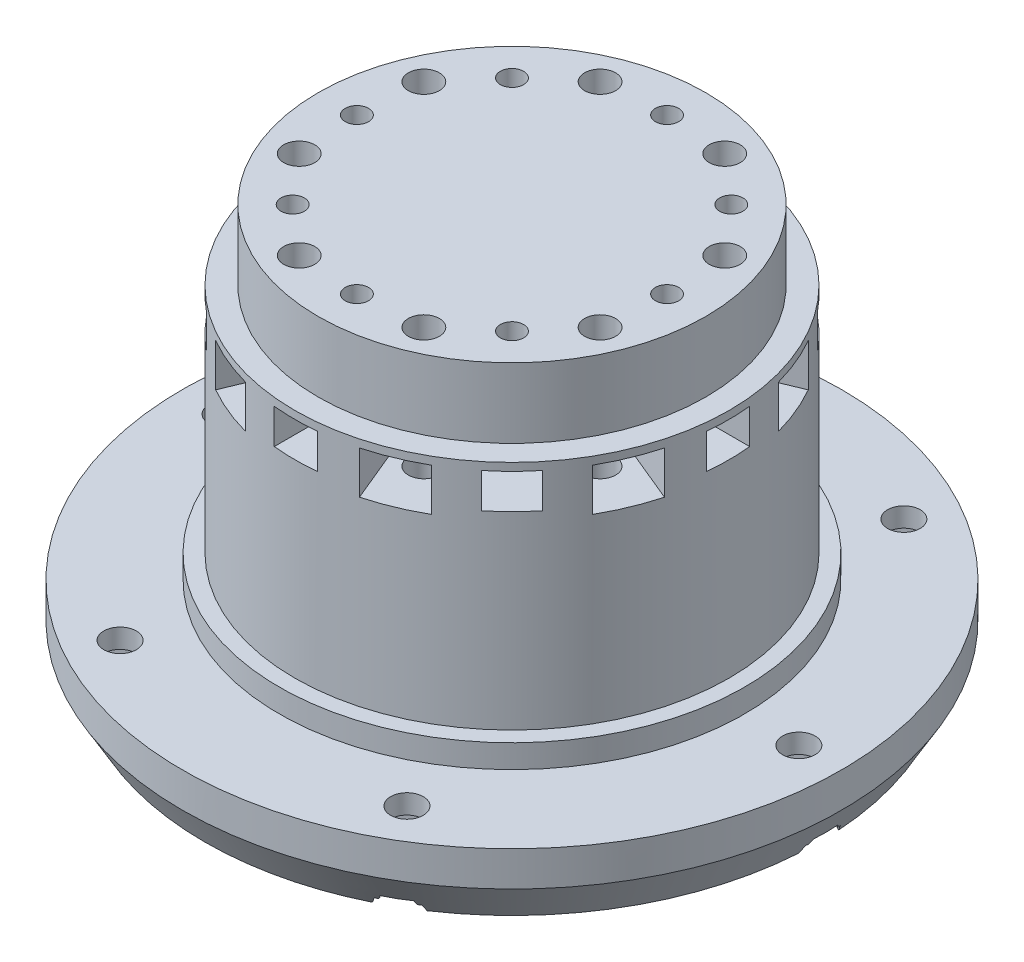
from build123d import *

# Parameters (mm, degrees)
SKETCH21_R          = 3.175
CUT_EXTRUDE13_DEPTH = 3.16
SKETCH18_R          = 2.1
CUT_EXTRUDE11_DEPTH = 80.085143991
CUT_EXTRUDE12_DEPTH = 7
SKETCH20_R          = 0.4
BOSS_EXTRUDE1_DEPTH = 2.5
CIRPATTERN1_COUNT   = 6
CHAMFER1_SIZE       = 2.886751346
CHAMFER1_SIZE_2     = 5
SKETCH22_R          = 1.5
SKETCH22_R_2        = 2
CUT_EXTRUDE14_DEPTH = 20
CUT_EXTRUDE15_START = -14.5
SKETCH23_R          = 1.5
CUT_EXTRUDE15_DEPTH = 4.5
CUT_EXTRUDE16_START = -15.5
SKETCH23_3_R        = 2
CUT_EXTRUDE16_DEPTH = 5.5
CIRPATTERN2_COUNT   = 8


with BuildPart() as part:
    # Sketch1 → Revolve1 (revolve)
    with BuildSketch(Plane.XY, mode=Mode.PRIVATE) as revolve1_sk:
        Polygon((0, 0), (-42.5, 0), (-42.5, 9.5), (-30, 9.5), (-30, 12.5), (0, 12.5), align=None)
    revolve(revolve1_sk.sketch.rotate(Axis((0, 0, 0), (0, 1, 0)), 270), axis=Axis((0, 0, 0), (0, 1, 0)))

    # Sketch2 → Revolve2 (revolve)
    with BuildSketch(Plane.XY, mode=Mode.PRIVATE) as revolve2_sk:
        Polygon((-28, 41.4), (-28, 12.5), (0, 12.5), (0, 41.4), (0, 51.4), (-25, 51.4), (-25, 42.4), (-28, 42.4), align=None)
        Polygon((0, -8.6), (-15, -8.6), (-15, -0.6), (-17.5, -0.6), (-17.5, 0), (0, 0), align=None)
    revolve(revolve2_sk.sketch.rotate(Axis((0, 0, 0), (0, 1, 0)), 270), axis=Axis((0, 0, 0), (0, 1, 0)))

    # Sketch21 → Cut-Extrude13 (cut)
    with BuildSketch(Plane.XZ.offset(8.6)):
        with Locations(Location((0, 0, 0), (0, 0, 270))):
            Circle(SKETCH21_R)
    extrude(amount=-CUT_EXTRUDE13_DEPTH, mode=Mode.SUBTRACT)

    # Sketch18 → Cut-Extrude11 (cut, through all)
    with BuildSketch(Plane.XZ):
        with Locations(Location((-37, 0, 0), (0, 0, 270))):
            Circle(SKETCH18_R)
        with Locations(Location((-18.5, 32.04293994, 0), (0, 0, 270))):
            Circle(SKETCH18_R)
        with Locations(Location((18.5, 32.04293994, 0), (0, 0, 270))):
            Circle(SKETCH18_R)
        with Locations(Location((37, 0, 0), (0, 0, 270))):
            Circle(SKETCH18_R)
        with Locations(Location((18.5, -32.04293994, 0), (0, 0, 270))):
            Circle(SKETCH18_R)
        with Locations(Location((-18.5, -32.04293994, 0), (0, 0, 270))):
            Circle(SKETCH18_R)
    extrude(amount=-CUT_EXTRUDE11_DEPTH, mode=Mode.SUBTRACT)

    # Sketch19 → Cut-Extrude12 (cut)
    with BuildSketch(Plane.XZ):
        Polygon((-33.5, -2.020725942), (-33.5, 2.020725942), (-37, 4.041451884), (-40.5, 2.020725942), (-40.5, -2.020725942), (-37, -4.041451884), align=None)
    cut_extrude12 = extrude(amount=-CUT_EXTRUDE12_DEPTH, mode=Mode.SUBTRACT)

    # Sketch20 → Boss-Extrude1 (add)
    with BuildSketch(Plane.XZ):
        with Locations((-40.5, 2.020725942)):
            Circle(SKETCH20_R)
        with Locations((-37, 4.041451884)):
            Circle(SKETCH20_R)
        with Locations((-33.5, 2.020725942)):
            Circle(SKETCH20_R)
        with Locations((-33.5, -2.020725942)):
            Circle(SKETCH20_R)
        with Locations((-37, -4.041451884)):
            Circle(SKETCH20_R)
        with Locations((-40.5, -2.020725942)):
            Circle(SKETCH20_R)
    boss_extrude1 = extrude(amount=-BOSS_EXTRUDE1_DEPTH)

    # CirPattern1: Cut-Extrude12, Boss-Extrude1 ×6 about axis
    cirpattern1_axis = Axis((0, 0, 0), (0, 1, 0))
    add([cut_extrude12.rotate(cirpattern1_axis, i * 360 / CIRPATTERN1_COUNT) for i in range(1, CIRPATTERN1_COUNT)], mode=Mode.SUBTRACT)
    add([boss_extrude1.rotate(cirpattern1_axis, i * 360 / CIRPATTERN1_COUNT) for i in range(1, CIRPATTERN1_COUNT)])

    # Chamfer1
    # the kernel refuses this chamfer: 5, 2.886751346 mm, written as the material it takes off along each edge
    with BuildSketch(Plane(origin=(0, 0, 0), x_dir=(0, 0, -1), z_dir=(1, 0, 0))) as chamfer1_piece_1:
        Polygon((42.5 - CHAMFER1_SIZE, 0), (42.5, CHAMFER1_SIZE_2), (42.5, 0), align=None)
    revolve(axis=Axis((0, 0, 0), (0, 1, 0)), mode=Mode.SUBTRACT)

    # Sketch22 → Cut-Extrude14 (cut)
    with BuildSketch(Plane(origin=(0, 51.4, 0), x_dir=(1, 0, 0), z_dir=(0, 1, 0))):
        with Locations(Location((0, 20, 0), (0, 0, 270))):
            Circle(SKETCH22_R)
        with Locations(Location((8.03635208, 19.401470183, 0), (0, 0, 270))):
            Circle(SKETCH22_R_2)
        with Locations(Location((14.142135624, 14.142135624, 0), (0, 0, 270))):
            Circle(SKETCH22_R)
        with Locations(Location((19.401470183, 8.03635208, 0), (0, 0, 270))):
            Circle(SKETCH22_R_2)
        with Locations(Location((20, 0, 0), (0, 0, 270))):
            Circle(SKETCH22_R)
        with Locations(Location((19.401470183, -8.03635208, 0), (0, 0, 270))):
            Circle(SKETCH22_R_2)
        with Locations(Location((14.142135624, -14.142135624, 0), (0, 0, 270))):
            Circle(SKETCH22_R)
        with Locations(Location((8.03635208, -19.401470183, 0), (0, 0, 270))):
            Circle(SKETCH22_R_2)
        with Locations(Location((0, -20, 0), (0, 0, 270))):
            Circle(SKETCH22_R)
        with Locations(Location((-8.03635208, -19.401470183, 0), (0, 0, 270))):
            Circle(SKETCH22_R_2)
        with Locations(Location((-14.142135624, -14.142135624, 0), (0, 0, 270))):
            Circle(SKETCH22_R)
        with Locations(Location((-19.401470183, -8.03635208, 0), (0, 0, 270))):
            Circle(SKETCH22_R_2)
        with Locations(Location((-20, 0, 0), (0, 0, 270))):
            Circle(SKETCH22_R)
        with Locations(Location((-19.401470183, 8.03635208, 0), (0, 0, 270))):
            Circle(SKETCH22_R_2)
        with Locations(Location((-14.142135624, 14.142135624, 0), (0, 0, 270))):
            Circle(SKETCH22_R)
        with Locations(Location((-8.03635208, 19.401470183, 0), (0, 0, 270))):
            Circle(SKETCH22_R_2)
    extrude(amount=-CUT_EXTRUDE14_DEPTH, mode=Mode.SUBTRACT)

    # Sketch23 → Cut-Extrude15 (cut)
    # profile 1 of 2: a face of its own
    with BuildSketch(Plane(origin=(0, 51.4, 0), x_dir=(1, 0, 0), z_dir=(0, 1, 0)).offset(CUT_EXTRUDE15_START)):
        with BuildLine():
            Line((-2.8, 24.842705167), (-2.8, 21.616580754))
            Line((-2.8, 21.616580754), (-2.8, 18.383419246))
            Line((-2.8, 18.383419246), (0, 16.766838493))
            Line((0, 16.766838493), (2.8, 18.383419246))
            Line((2.8, 18.383419246), (2.8, 21.616580754))
            Line((2.8, 21.616580754), (2.8, 24.842705167))
            ThreePointArc((2.8, 24.842705167), (0, 25), (-2.8, 24.842705167))
        make_face()
        with Locations(Location((0, 20, 0), (0, 0, 270))):
            Circle(SKETCH23_R, mode=Mode.SUBTRACT)
    # profile 2 of 2: a face of its own
    with BuildSketch(Plane(origin=(0, 51.4, 0), x_dir=(1, 0, 0), z_dir=(0, 1, 0)).offset(CUT_EXTRUDE15_START)):
        with BuildLine():
            Line((-2.8, 27.859648239), (-2.8, 24.842705167))
            ThreePointArc((-2.8, 24.842705167), (0, 25), (2.8, 24.842705167))
            Line((2.8, 24.842705167), (2.8, 27.859648239))
            ThreePointArc((2.8, 27.859648239), (0, 28), (-2.8, 27.859648239))
        make_face()
    cut_extrude15 = extrude(amount=CUT_EXTRUDE15_DEPTH, mode=Mode.SUBTRACT)

    # Sketch23<3> → Cut-Extrude16 (cut)
    # profile 1 of 2: a face of its own
    with BuildSketch(Plane(origin=(0, 51.4, 0), x_dir=(1, 0, 0), z_dir=(0, 1, 0)).offset(CUT_EXTRUDE16_START)):
        with BuildLine():
            ThreePointArc((12.749911594, 21.504412439), (9.567085809, 23.096988313), (6.190366913, 24.221464809))
            Line((6.190366913, 24.221464809), (5.540925198, 22.653573811))
            Line((5.540925198, 22.653573811), (3.972234281, 18.866418924))
            Line((3.972234281, 18.866418924), (6.467661163, 15.614315295))
            Line((6.467661163, 15.614315295), (10.531778962, 16.149366554))
            Line((10.531778962, 16.149366554), (12.100469879, 19.936521441))
            Line((12.100469879, 19.936521441), (12.749911594, 21.504412439))
        make_face()
        with Locations(Location((8.03635208, 19.401470183, 0), (0, 0, 270))):
            Circle(SKETCH23_3_R, mode=Mode.SUBTRACT)
    # profile 2 of 2: a face of its own
    with BuildSketch(Plane(origin=(0, 51.4, 0), x_dir=(1, 0, 0), z_dir=(0, 1, 0)).offset(CUT_EXTRUDE16_START)):
        with BuildLine():
            Line((7.34889401, 27.018396637), (6.190366913, 24.221464809))
            ThreePointArc((6.190366913, 24.221464809), (9.567085809, 23.096988313), (12.749911594, 21.504412439))
            Line((12.749911594, 21.504412439), (13.90843869, 24.301344267))
            ThreePointArc((13.90843869, 24.301344267), (10.715136106, 25.86862691), (7.34889401, 27.018396637))
        make_face()
    cut_extrude16 = extrude(amount=CUT_EXTRUDE16_DEPTH, mode=Mode.SUBTRACT)

    # CirPattern2: Cut-Extrude15, Cut-Extrude16 ×8 about axis
    cirpattern2_axis = Axis((0, 0, 0), (0, 1, 0))
    add([cut_extrude15.rotate(cirpattern2_axis, i * 360 / CIRPATTERN2_COUNT) for i in range(1, CIRPATTERN2_COUNT)], mode=Mode.SUBTRACT)
    add([cut_extrude16.rotate(cirpattern2_axis, i * 360 / CIRPATTERN2_COUNT) for i in range(1, CIRPATTERN2_COUNT)], mode=Mode.SUBTRACT)


solid = part.part
